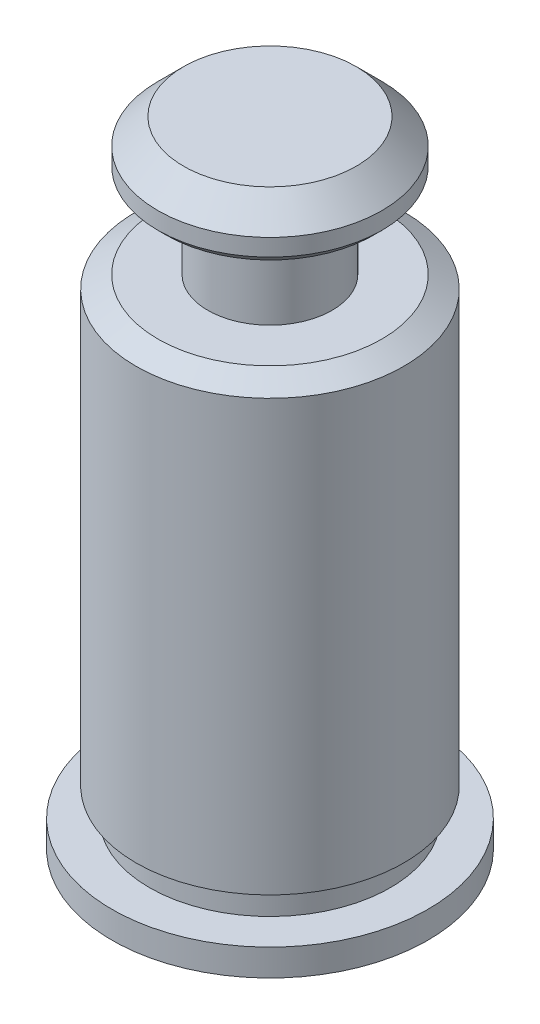
from build123d import *


with BuildPart() as part:
    # BodySke → Body (revolve)
    with BuildSketch(Plane.XY):
        Polygon((2.69, 0), (3.175, 0), (3.175, 0.538), (2.421, 0.538), (2.421, 1.1029), (2.69, 1.1029), (2.69, 9.745965882), (2.25, 10), (1.25, 10), (1.25, 11.72), (2.078333333, 11.72), (2.25, 11.891666667), (2.25, 12.235), (1.735, 12.75), (0, 12.75), (0, 0.00508), (2.69, 0.00508), align=None)
    revolve(axis=Axis((0, 0, 0), (0, 1, 0)))


solid = part.part
